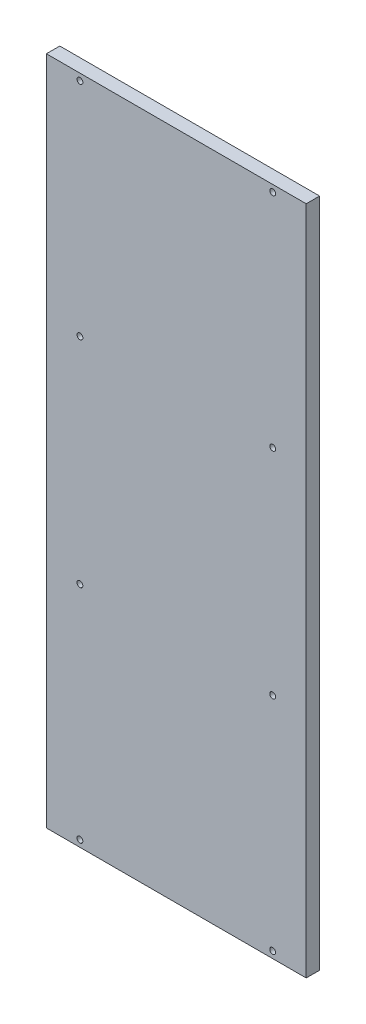
from build123d import *

# Parameters (mm, degrees)
SKETCH_1_W          = 310
SKETCH_1_H          = 800
EXTRUDE_5910_DEPTH  = 16
SKETCH_3_R          = 3.5
CUT_EXTRUDE_1_DEPTH = 16
SKETCH_4_R          = 3.5
CUT_EXTRUDE_2_DEPTH = 16
SKETCH_5_R          = 3.5
CUT_EXTRUDE_3_DEPTH = 16
SKETCH_6_R          = 3.5
CUT_EXTRUDE_4_DEPTH = 16
SKETCH_7_R          = 3.5
CUT_EXTRUDE_5_DEPTH = 16
SKETCH_8_R          = 3.5
CUT_EXTRUDE_6_DEPTH = 16
SKETCH_9_R          = 3.5
CUT_EXTRUDE_7_DEPTH = 16
SKETCH_10_R         = 3.5
CUT_EXTRUDE_8_DEPTH = 16


with BuildPart() as part:
    # Эскиз1 → Extrude 5910 (new body)
    with BuildSketch(Plane.XY):
        with Locations((155, 400)):
            Rectangle(SKETCH_1_W, SKETCH_1_H)
    extrude(amount=EXTRUDE_5910_DEPTH)

    # Эскиз3 → Cut-Extrude 1 (cut)
    with BuildSketch(Plane.XY.offset(16)):
        with Locations((40, 8)):
            Circle(SKETCH_3_R)
    extrude(amount=-CUT_EXTRUDE_1_DEPTH, mode=Mode.SUBTRACT)

    # Эскиз4 → Cut-Extrude 2 (cut)
    with BuildSketch(Plane.XY.offset(16)):
        with Locations((270, 8)):
            Circle(SKETCH_4_R)
    extrude(amount=-CUT_EXTRUDE_2_DEPTH, mode=Mode.SUBTRACT)

    # Эскиз5 → Cut-Extrude 3 (cut)
    with BuildSketch(Plane.XY.offset(16)):
        with Locations((40, 792)):
            Circle(SKETCH_5_R)
    extrude(amount=-CUT_EXTRUDE_3_DEPTH, mode=Mode.SUBTRACT)

    # Эскиз6 → Cut-Extrude 4 (cut)
    with BuildSketch(Plane.XY.offset(16)):
        with Locations((270, 792)):
            Circle(SKETCH_6_R)
    extrude(amount=-CUT_EXTRUDE_4_DEPTH, mode=Mode.SUBTRACT)

    # Эскиз7 → Отверстие 5 (cut)
    with BuildSketch(Plane.XY.offset(16)):
        with Locations((40, 272)):
            Circle(SKETCH_7_R)
    extrude(amount=-CUT_EXTRUDE_5_DEPTH, mode=Mode.SUBTRACT)

    # Эскиз8 → Отверстие 6 (cut)
    with BuildSketch(Plane.XY.offset(16)):
        with Locations((270, 272)):
            Circle(SKETCH_8_R)
    extrude(amount=-CUT_EXTRUDE_6_DEPTH, mode=Mode.SUBTRACT)

    # Эскиз9 → Отверстие 7 (cut)
    with BuildSketch(Plane.XY.offset(16)):
        with Locations((40, 528)):
            Circle(SKETCH_9_R)
    extrude(amount=-CUT_EXTRUDE_7_DEPTH, mode=Mode.SUBTRACT)

    # Эскиз10 → Отверстие 8 (cut)
    with BuildSketch(Plane.XY.offset(16)):
        with Locations((270, 528)):
            Circle(SKETCH_10_R)
    extrude(amount=-CUT_EXTRUDE_8_DEPTH, mode=Mode.SUBTRACT)


solid = part.part
